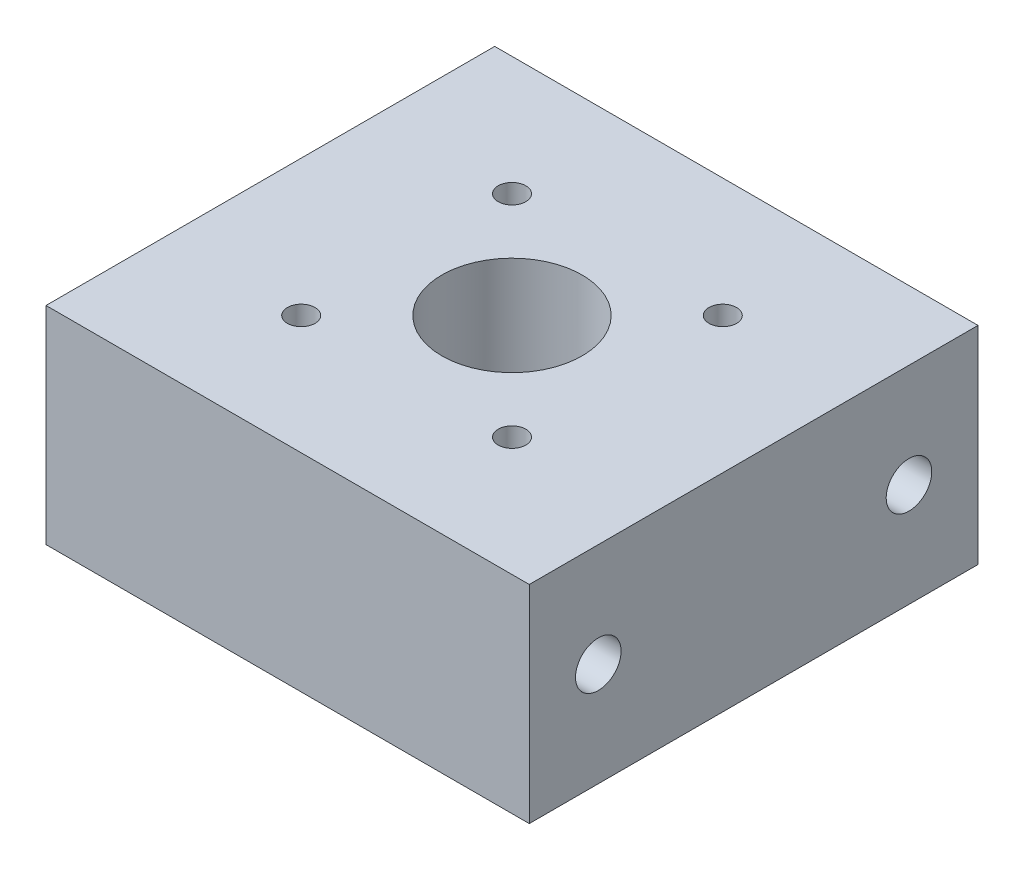
from build123d import *

# Parameters (mm, degrees)
SKETCH1_W             = 35
SKETCH1_H             = 32.5
BOSS_EXTRUDE1_DEPTH   = 15
SKETCH2_R             = 5.08
CUT_EXTRUDE2_DEPTH    = 30
SKETCH4_R             = 1
CUT_EXTRUDE3_DEPTH    = 14.7
M4X0_7_TAPPED_HOLE1_D = 3.3


with BuildPart() as part:
    # Sketch1 → Boss-Extrude1 (new body)
    with BuildSketch(Plane(origin=(0, 0, 0), x_dir=(1, 0, 0), z_dir=(0, 1, 0))):
        Rectangle(SKETCH1_W, SKETCH1_H)
    extrude(amount=-BOSS_EXTRUDE1_DEPTH)

    # Sketch2 → Cut-Extrude2 (cut)
    with BuildSketch(Plane(origin=(0, 0, 0), x_dir=(1, 0, 0), z_dir=(0, 1, 0))):
        Circle(SKETCH2_R)
    extrude(amount=-CUT_EXTRUDE2_DEPTH, mode=Mode.SUBTRACT)

    # Sketch4 → Cut-Extrude3 (cut)
    with BuildSketch(Plane(origin=(0, 0, 0), x_dir=(1, 0, 0), z_dir=(0, 1, 0))):
        with Locations((7.633, 7.633)):
            Circle(SKETCH4_R)
        with Locations((-7.633, 7.633)):
            Circle(SKETCH4_R)
        with Locations((-7.633, -7.633)):
            Circle(SKETCH4_R)
        with Locations((7.633, -7.633)):
            Circle(SKETCH4_R)
    extrude(amount=-CUT_EXTRUDE3_DEPTH, mode=Mode.SUBTRACT)

    # M4x0.7 Tapped Hole1 (through all)
    with Locations(Plane(origin=(-17.5, 0, 0), x_dir=(0, -1, 0), z_dir=(-1, 0, 0))):
        with Locations((7.5, -11.25), (7.5, 11.25)):
            Hole(M4X0_7_TAPPED_HOLE1_D / 2)


solid = part.part
